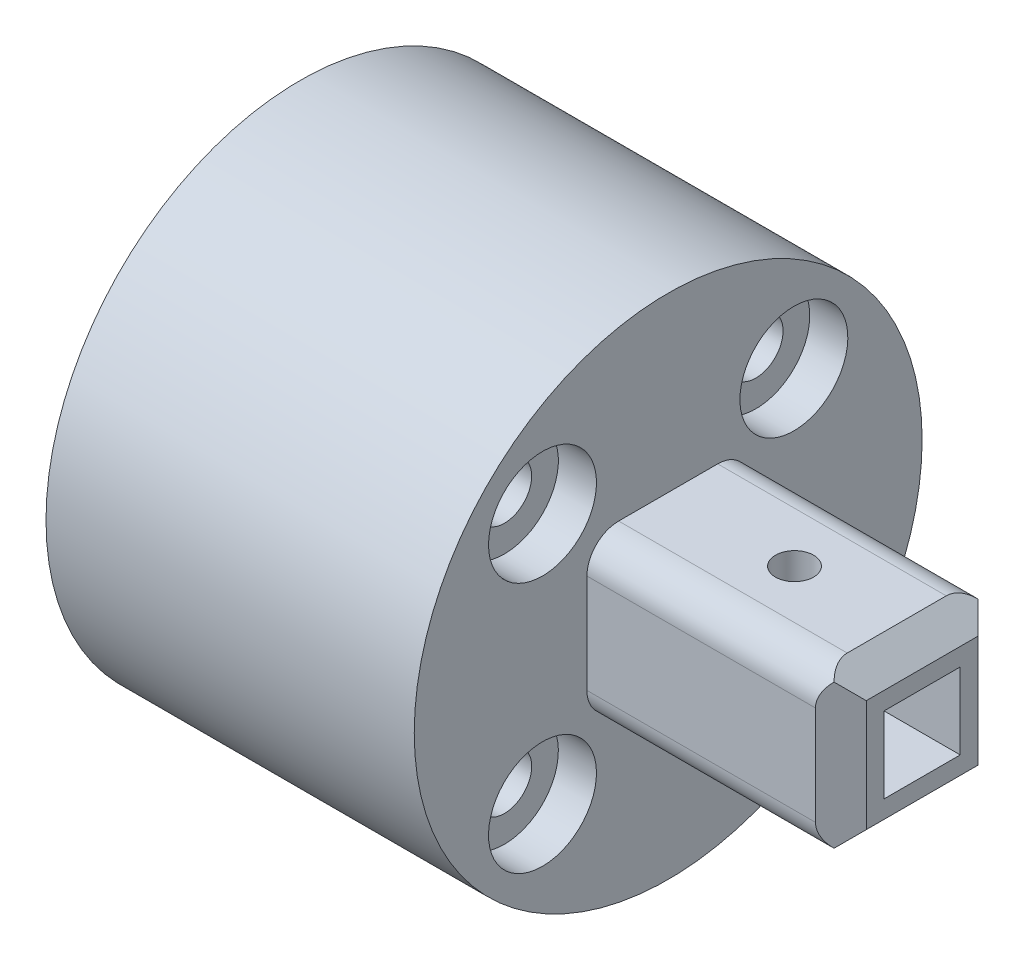
from build123d import *

# Parameters (mm, degrees)
SKETCH_1_R               = 20
EXTRUDE_1_DEPTH          = 10
SKETCH_2_W               = 15
SKETCH_2_H               = 30.5
CUT_EXTRUDE_1_DEPTH      = 4
SKETCH_3_R               = 8.75
CUT_EXTRUDE_2_DEPTH      = 4
EXTRUDE_START            = 19
SKETCH_4_R               = 20
SKETCH_4_W               = 18
SKETCH_4_H               = 32
EXTRUDE_2_DEPTH          = 19
FILLET_1_R               = 3
SKETCH_5_R               = 2.5
CUT_EXTRUDE_3_DEPTH      = 20
FILLET_2_R               = 3
SKETCH_6_R               = 2.15
CUT_EXTRUDE_4_DEPTH      = 43
FILLET_3_R               = 1
SKETCH_7_R               = 4.25
CUT_EXTRUDE_5_DEPTH      = 3
PATTERN_CIRCULAR_1_COUNT = 4
SKETCH_8_W               = 12.8
SKETCH_8_H               = 12.8
EXTRUDE_3_DEPTH          = 20
SKETCH_9_W               = 6
SKETCH_9_H               = 6
CUT_EXTRUDE_6_DEPTH      = 35
SKETCH_10_W              = 3
SKETCH_10_H              = 15
CUT_EXTRUDE_7_DEPTH      = 5
SKETCH_11_R              = 2.5
CUT_EXTRUDE_8_DEPTH      = 5
SKETCH_12_R              = 1.5
CUT_EXTRUDE_9_DEPTH      = 17
CHAMFER_1_SIZE           = 2
FILLET_4_R               = 3
FILLET_5_R               = 2.5


with BuildPart() as part:
    # 草图1 → 凸台-拉伸1 (new body)
    with BuildSketch(Plane(origin=(0, 0, 0), x_dir=(0, 0, -1), z_dir=(1, 0, 0))):
        Circle(SKETCH_1_R)
    extrude(amount=EXTRUDE_1_DEPTH)

    # 草图2 → 切除-拉伸1 (cut)
    with BuildSketch(Plane.ZY):
        Rectangle(SKETCH_2_W, SKETCH_2_H)
    extrude(amount=-CUT_EXTRUDE_1_DEPTH, mode=Mode.SUBTRACT)

    # 草图3 → 切除-拉伸2 (cut)
    with BuildSketch(Plane.ZY.offset(-4)):
        Circle(SKETCH_3_R)
    extrude(amount=CUT_EXTRUDE_2_DEPTH, mode=Mode.SUBTRACT)

    # 草图4 → 凸台-拉伸2 (add)
    with BuildSketch(Plane.ZY.offset(EXTRUDE_START)):
        Circle(SKETCH_4_R)
        Rectangle(SKETCH_4_W, SKETCH_4_H, mode=Mode.SUBTRACT)
    extrude(amount=-EXTRUDE_2_DEPTH)

    # 圆角1
    fillet_1_edges = [part.edges().sort_by_distance(p)[0] for p in [
        (-9.5, 16, 9),
        (-9.5, 16, -9),
        (-9.5, -16, -9),
        (-9.5, -16, 9),
    ]]
    fillet(fillet_1_edges, radius=FILLET_1_R)

    # 草图5 → 切除-拉伸3 (cut)
    with BuildSketch(Plane.ZY.offset(19)):
        with Locations((0, -16)):
            Circle(SKETCH_5_R)
        with Locations((0, 16)):
            Circle(SKETCH_5_R)
    extrude(amount=-CUT_EXTRUDE_3_DEPTH, mode=Mode.SUBTRACT)

    # 圆角2
    # the kernel refuses this fillet: 3 mm, written as the material it takes off along each edge
    with BuildSketch(Plane(origin=(-24.274430572, -16, 2.5), x_dir=(0, -0.9586814917396833, -0.2844816292764363), z_dir=(1, 0, 0))) as fillet_2_piece_1:
        with BuildLine():
            CenterArc((2.275853034, -2.876044475), FILLET_2_R, 106.527865575, 56.944268849)
            Line((-0.600191441, -2.022599587), (0, 0))
            ThreePointArc((0, 0), (0.711204073, -0.103296271), (1.422408146, 0))
        make_face()
    extrude(amount=24.274430572, mode=Mode.SUBTRACT)
    with BuildSketch(Plane(origin=(0, -16, -2.5), x_dir=(0, 0, -1), z_dir=(-1, 0, 0))) as fillet_2_piece_2:
        with BuildLine():
            CenterArc((2.109772229, 3), FILLET_2_R, 213.055731151, 56.944268849)
            ThreePointArc((-0.404648987, 1.363636364), (-0.103296271, 0.711204073), (0, 0))
            Line((0, 0), (2.109772229, 0))
        make_face()
    extrude(amount=24.274430572, mode=Mode.SUBTRACT)
    with BuildSketch(Plane(origin=(0, 16, -2.5), x_dir=(0, 0.9586814917396834, 0.2844816292764354), z_dir=(-1, 0, 0))) as fillet_2_piece_3:
        with BuildLine():
            CenterArc((2.275853034, 2.876044475), FILLET_2_R, 196.527865575, 56.944268849)
            Line((-0.600191441, 2.022599587), (0, 0))
            ThreePointArc((0, 0), (0.711204073, 0.103296271), (1.422408146, 0))
        make_face()
    extrude(amount=24.274430572, mode=Mode.SUBTRACT)
    with BuildSketch(Plane(origin=(-24.274430572, 16, 2.5), x_dir=(0, 0, 1), z_dir=(1, 0, 0))) as fillet_2_piece_4:
        with BuildLine():
            CenterArc((2.109772229, -3), FILLET_2_R, 90, 56.944268849)
            ThreePointArc((-0.404648987, -1.363636364), (-0.103296271, -0.711204073), (0, 0))
            Line((0, 0), (2.109772229, 0))
        make_face()
    extrude(amount=24.274430572, mode=Mode.SUBTRACT)

    # 草图6 → 切除-拉伸4 (cut)
    with BuildSketch(Plane(origin=(10, 0, 0), x_dir=(0, 0, -1), z_dir=(1, 0, 0))):
        with Locations((9.899494937, -9.899494937)):
            Circle(SKETCH_6_R)
        with Locations((-9.899494937, -9.899494937)):
            Circle(SKETCH_6_R)
        with Locations((-9.899494937, 9.899494937)):
            Circle(SKETCH_6_R)
        with Locations((9.899494937, 9.899494937)):
            Circle(SKETCH_6_R)
    extrude(amount=-CUT_EXTRUDE_4_DEPTH, mode=Mode.SUBTRACT)

    # 圆角3
    # the kernel refuses this fillet: 1 mm, written as the material it takes off along each edge
    with BuildSketch(Plane(origin=(-21.98900269, -7.946699797, 9), x_dir=(0, 0.1985408891964352, 0.9800926054802622), z_dir=(1, 0, 0)), Plane(origin=(-21.98900269, 7.946699797, -9), x_dir=(0, -0.19854088919647347, -0.9800926054802545), z_dir=(1, 0, 0))) as fillet_3_piece_1:
        with BuildLine():
            CenterArc((1.217468306, -0.973258884), FILLET_3_R, 103.280057781, 88.171589383)
            Line((0.237375701, -1.171799774), (0, 0))
            ThreePointArc((0, 0), (0.493878653, -0.057493399), (0.987757305, 0))
        make_face()
    extrude(amount=21.98900269, mode=Mode.SUBTRACT)
    with BuildSketch(Plane(origin=(-21.959087911, -11.852290077, 9), x_dir=(0, -0.999999983485678, -0.00018173784322620402), z_dir=(1, 0, 0)), Plane(origin=(-21.959087911, 11.852290077, -9), x_dir=(0, 0.9999999834856781, 0.00018173784322619477), z_dir=(1, 0, 0))) as fillet_3_piece_2:
        with BuildLine():
            CenterArc((1.195428513, -0.999930456), FILLET_3_R, 90.675724778, 87.490671362)
            Line((0.195940547, -0.967933494), (0.09599175, -0.964733798))
            ThreePointArc((0.09599175, -0.964733798), (0.056286672, -0.492404834), (-0.090835283, -0.041820466))
            Line((-0.090835283, -0.041820466), (1.8174e-05, 0.099999998))
            ThreePointArc((1.8174e-05, 0.099999998), (1.147728078, 0.099791416), (1.182455829, 0.099993046))
            Line((1.182455829, 0.099993046), (1.183635164, 0))
        make_face()
    extrude(amount=21.959087911, mode=Mode.SUBTRACT)
    with BuildSketch(Plane(origin=(-21.959087911, -11.852290077, -9), x_dir=(0, -0.19858553154825268, -0.98008356105982), z_dir=(1, 0, 0)), Plane(origin=(-21.959087911, 11.852290077, 9), x_dir=(0, 0.19858553154822475, 0.9800835610598256), z_dir=(1, 0, 0))) as fillet_3_piece_3:
        with BuildLine():
            CenterArc((1.217233349, -0.973269347), FILLET_3_R, 103.277447997, 87.490671362)
            Line((0.234841987, -1.160104066), (0.136602851, -1.178787538))
            ThreePointArc((0.136602851, -1.178787538), (0.129910229, -1.144710182), (-0.098008356, -0.019858553))
            Line((-0.098008356, -0.019858553), (0.022966667, 0.097326935))
            ThreePointArc((0.022966667, 0.097326935), (0.49378334, 0.042529095), (0.964600013, 0.097326935))
            Line((0.964600013, 0.097326935), (0.987566679, 0))
        make_face()
    extrude(amount=21.959087911, mode=Mode.SUBTRACT)
    with BuildSketch(Plane(origin=(-21.98900269, -7.946699797, -9), x_dir=(0, 1, 0), z_dir=(1, 0, 0)), Plane(origin=(-21.98900269, 7.946699797, 9), x_dir=(0, -1, 0), z_dir=(1, 0, 0))) as fillet_3_piece_4:
        with BuildLine():
            CenterArc((1.195601076, -1), FILLET_3_R, 90, 88.171589383)
            ThreePointArc((0.196110214, -0.968093631), (0.154403962, -0.472632025), (0, 0))
            Line((0, 0), (1.195601076, 0))
        make_face()
    extrude(amount=21.98900269, mode=Mode.SUBTRACT)

    # 草图7 → 切除-拉伸5 (cut)
    with BuildSketch(Plane(origin=(10, 0, 0), x_dir=(0, 0, -1), z_dir=(1, 0, 0))):
        with Locations((9.899494937, -9.899494937)):
            Circle(SKETCH_7_R)
    cut_extrude_5 = extrude(amount=-CUT_EXTRUDE_5_DEPTH, mode=Mode.SUBTRACT)

    # 阵列(圆周)1: 切除-拉伸5 ×4 about axis
    pattern_circular_1_axis = Axis((0, 0, 0), (1, 0, 0))
    for i in range(1, PATTERN_CIRCULAR_1_COUNT):
        add(cut_extrude_5.rotate(pattern_circular_1_axis, i * 360 / PATTERN_CIRCULAR_1_COUNT), mode=Mode.SUBTRACT)

    # 草图8 → 凸台-拉伸3 (add)
    with BuildSketch(Plane(origin=(10, 0, 0), x_dir=(0, 0, -1), z_dir=(1, 0, 0))):
        Rectangle(SKETCH_8_W, SKETCH_8_H)
    extrude(amount=EXTRUDE_3_DEPTH)

    # 草图9 → 切除-拉伸6 (cut)
    with BuildSketch(Plane(origin=(30, 0, 0), x_dir=(0, 0, -1), z_dir=(1, 0, 0))):
        Rectangle(SKETCH_9_W, SKETCH_9_H)
    extrude(amount=-CUT_EXTRUDE_6_DEPTH, mode=Mode.SUBTRACT)

    # 草图10 → 切除-拉伸7 (cut)
    with BuildSketch(Plane.ZY.offset(-1)):
        with Locations((0, 10.5)):
            Rectangle(SKETCH_10_W, SKETCH_10_H)
    extrude(amount=-CUT_EXTRUDE_7_DEPTH, mode=Mode.SUBTRACT)

    # 草图11 → 切除-拉伸8 (cut)
    with BuildSketch(Plane.ZY.offset(-1)):
        with Locations((0, 16)):
            Circle(SKETCH_11_R)
    extrude(amount=-CUT_EXTRUDE_8_DEPTH, mode=Mode.SUBTRACT)

    # 草图12 → 切除-拉伸9 (cut)
    with BuildSketch(Plane.XZ.offset(6.4)):
        with Locations(Location((20, 0.05, 0), (0, 0, 270))):
            Circle(SKETCH_12_R)
    extrude(amount=-CUT_EXTRUDE_9_DEPTH, mode=Mode.SUBTRACT)

    # 倒角1
    chamfer_1_edges = [part.edges().sort_by_distance(p)[0] for p in [
        (30, 0, 6.4),
        (30, -6.4, 0),
        (30, 0, -6.4),
        (30, 6.4, 0),
    ]]
    chamfer(chamfer_1_edges, length=CHAMFER_1_SIZE)

    # 圆角4
    fillet_4_edges = [part.edges().sort_by_distance(p)[0] for p in [
        (6, 3, 0),
    ]]
    fillet(fillet_4_edges, radius=FILLET_4_R)

    # 圆角5
    fillet_5_edges = [part.edges().sort_by_distance(p)[0] for p in [
        (19, -6.4, 6.4),
        (19, 6.4, 6.4),
        (19, 6.4, -6.4),
        (19, -6.4, -6.4),
    ]]
    fillet(fillet_5_edges, radius=FILLET_5_R)


solid = part.part
